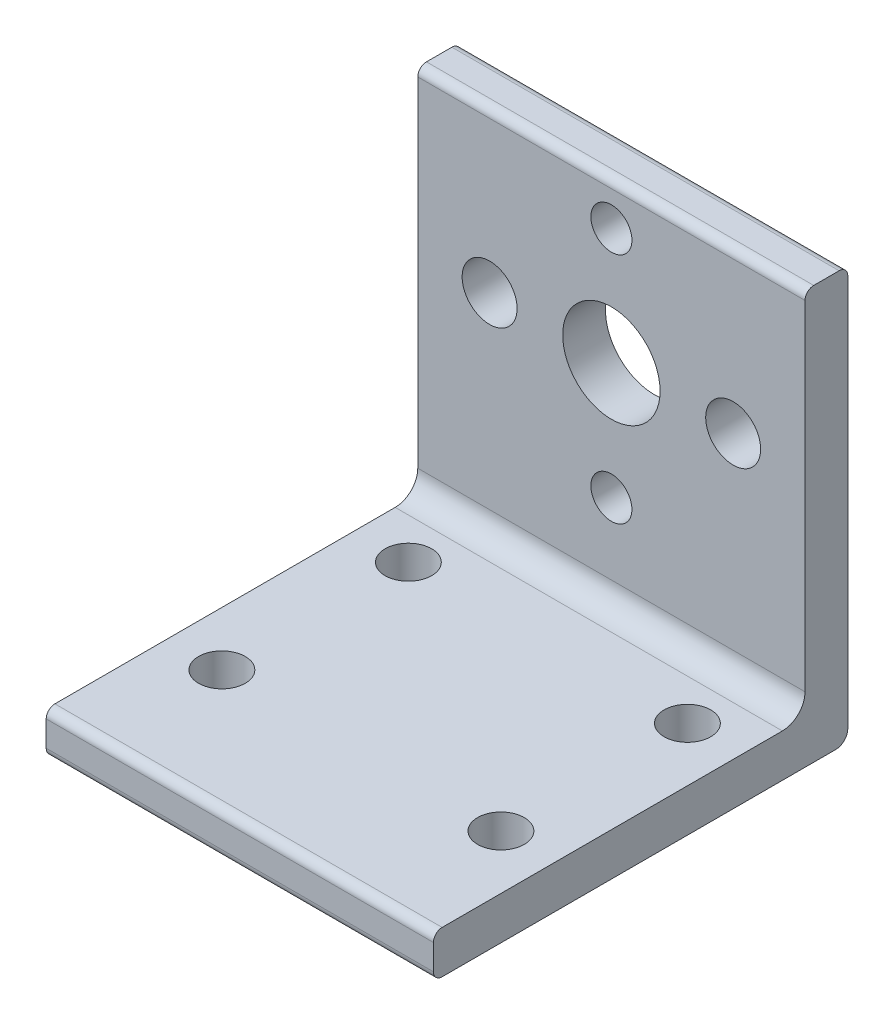
from build123d import *

# Parameters (mm, degrees)
BOSS_EXTRUDE1_DEPTH     = 28.2702
SKETCH2_R               = 3.556
SKETCH2_R_2             = 1.4986
SKETCH2_R_3             = 2.0066
MOTOR_MOUNT_HOLES_DEPTH = 50.437835996
SKETCH3_R               = 1.7018
PLATE_MOUNT_HOLES_DEPTH = 50.444256141
FILLET1_R               = 1.651
FILLET2_R               = 0.889
FILLET3_R               = 0.635


with BuildPart() as part:
    # Sketch1 → Boss-Extrude1 (new body)
    with BuildSketch(Plane(origin=(0, 0, 0), x_dir=(0, 0, -1), z_dir=(1, 0, 0))):
        Polygon((0, 0), (0, -30.1498), (-30.2514, -30.1498), (-30.2514, -27.0256), (-3.1242, -27.0256), (-3.1242, 0), align=None)
    extrude(amount=BOSS_EXTRUDE1_DEPTH)

    # Sketch2 → Motor_Mount_holes (cut, through all)
    with BuildSketch(Plane.XY.offset(3.1242)):
        with Locations((14.1351, -11.6586)):
            Circle(SKETCH2_R)
        with Locations((14.1351, -3.1496)):
            Circle(SKETCH2_R_2)
        with Locations((5.2451, -11.6586)):
            Circle(SKETCH2_R_3)
        with Locations((23.0251, -11.6586)):
            Circle(SKETCH2_R_3)
        with Locations((14.1351, -20.1676)):
            Circle(SKETCH2_R_2)
    extrude(amount=-MOTOR_MOUNT_HOLES_DEPTH, mode=Mode.SUBTRACT)

    # Sketch3 → Plate_Mount_Holes (cut, through all)
    with BuildSketch(Plane(origin=(0, -27.0256, 0), x_dir=(1, 0, 0), z_dir=(0, 1, 0))):
        with Locations((24.3205, -7.7597)):
            Circle(SKETCH3_R)
        with Locations((3.9497, -7.7597)):
            Circle(SKETCH3_R)
        with Locations((3.9497, -21.3741)):
            Circle(SKETCH3_R)
        with Locations((24.3205, -21.3741)):
            Circle(SKETCH3_R)
    extrude(amount=-PLATE_MOUNT_HOLES_DEPTH, mode=Mode.SUBTRACT)

    # Fillet1
    fillet1_edges = [part.edges().sort_by_distance(p)[0] for p in [
        (14.1351, -27.0256, 3.1242),
    ]]
    fillet(fillet1_edges, radius=FILLET1_R)

    # Fillet2
    fillet2_edges = [part.edges().sort_by_distance(p)[0] for p in [
        (14.1351, -30.1498, 0),
    ]]
    fillet(fillet2_edges, radius=FILLET2_R)

    # Fillet3
    fillet3_edges = [part.edges().sort_by_distance(p)[0] for p in [
        (14.1351, -30.1498, 30.2514),
        (14.1351, -27.0256, 30.2514),
        (14.1351, 0, 0),
        (14.1351, 0, 3.1242),
    ]]
    fillet(fillet3_edges, radius=FILLET3_R)


solid = part.part
